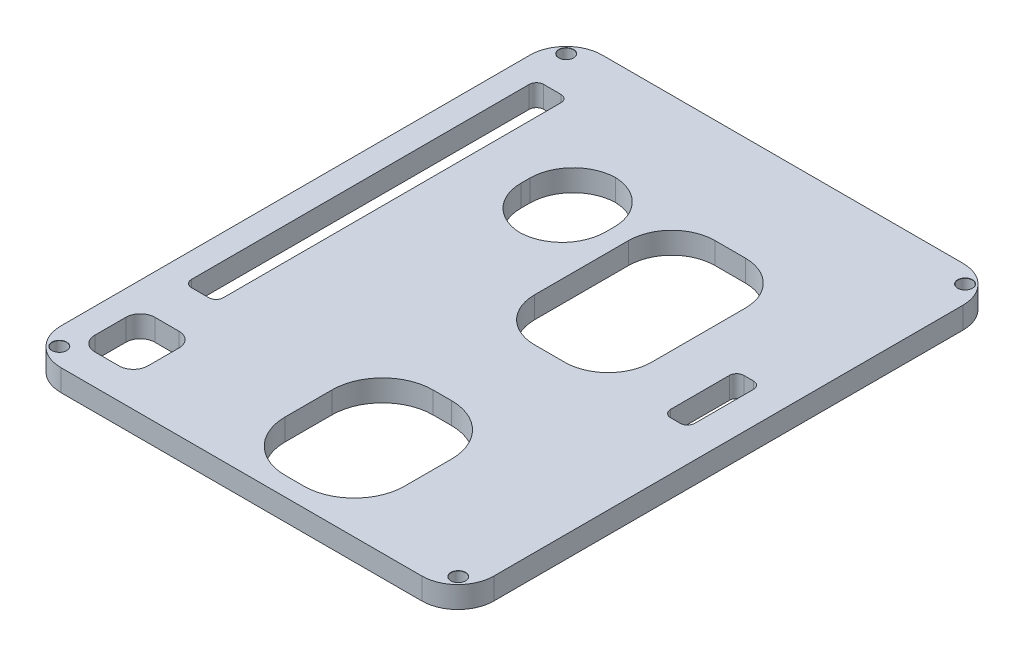
from build123d import *

# Parameters (mm, degrees)
SKIZZE1_W                                = 60
SKIZZE1_H                                = 75
AUFSATZ_LINEAR_AUSTRAGEN1_DEPTH          = 3
VERRUNDUNG1_R                            = 5
F_2_0_2_DURCHMESSER_BOHRUNG1_D           = 2
F_2_0_2_DURCHMESSER_BOHRUNG1_DEPTH       = 20
F_2_0_2_DURCHMESSER_BOHRUNG1_CSINK_D     = 2.05
F_2_0_2_DURCHMESSER_BOHRUNG1_CSINK_ANGLE = 90
F_2_0_2_DURCHMESSER_BOHRUNG1_TIP         = 0.600860619
SKIZZE4_W                                = 25.006881973
SKIZZE4_H                                = 16.195641819
SKIZZE4_W_2                              = 8.317021013
SKIZZE4_H_2                              = 7.361730429
SKIZZE4_W_3                              = 20.485548402
SKIZZE4_H_3                              = 16.578223094
SKIZZE4_W_4                              = 10.159045801
SKIZZE4_H_4                              = 3.349135978
SKIZZE4_W_5                              = 48.785747421
SKIZZE4_H_5                              = 4.403326981
SKIZZE4_W_6                              = 13.233304068
SKIZZE4_H_6                              = 11.709766254
SCHNITT_LINEAR_AUSTRAGEN1_DEPTH          = 5
VERRUNDUNG2_R                            = 6
VERRUNDUNG3_R                            = 1
VERRUNDUNG4_R                            = 7
VERRUNDUNG5_R                            = 2


with BuildPart() as part:
    # Skizze1 → Aufsatz-Linear austragen1 (new body)
    with BuildSketch(Plane(origin=(0, 0, 0), x_dir=(1, 0, 0), z_dir=(0, 1, 0))):
        Rectangle(SKIZZE1_W, SKIZZE1_H)
    extrude(amount=AUFSATZ_LINEAR_AUSTRAGEN1_DEPTH)

    # Verrundung1
    verrundung1_edges = [part.edges().sort_by_distance(p)[0] for p in [
        (30, 1.5, 37.5),
        (-30, 1.5, 37.5),
        (-30, 1.5, -37.5),
        (30, 1.5, -37.5),
    ]]
    fillet(verrundung1_edges, radius=VERRUNDUNG1_R)

    # Ø2.0 (2) Durchmesser Bohrung1
    with Locations(Plane.ZX.offset(3)):
        with Locations((-35.165927774, 27.602462356), (35.054289908, 27.602462356), (35.054289908, -27.658281289), (-35.165927774, -27.658281289)):
            CounterSinkHole(F_2_0_2_DURCHMESSER_BOHRUNG1_D / 2, F_2_0_2_DURCHMESSER_BOHRUNG1_CSINK_D / 2, depth=F_2_0_2_DURCHMESSER_BOHRUNG1_DEPTH, counter_sink_angle=F_2_0_2_DURCHMESSER_BOHRUNG1_CSINK_ANGLE)
            with Locations((0, 0, -(F_2_0_2_DURCHMESSER_BOHRUNG1_DEPTH + F_2_0_2_DURCHMESSER_BOHRUNG1_TIP / 2))):  # 118° drill point
                Cone(0, F_2_0_2_DURCHMESSER_BOHRUNG1_D / 2, F_2_0_2_DURCHMESSER_BOHRUNG1_TIP, mode=Mode.SUBTRACT)

    # Skizze4 → Schnitt-Linear austragen1 (cut)
    with BuildSketch(Plane.ZX.offset(3)):
        with Locations((-10.549778333, 7.176808516)):
            Rectangle(SKIZZE4_W, SKIZZE4_H)
        with Locations((29.109573547, -22.854668692)):
            Rectangle(SKIZZE4_W_2, SKIZZE4_H_2)
        with Locations((24.644058909, 4.744609303)):
            Rectangle(SKIZZE4_W_3, SKIZZE4_H_3)
        with Locations((-3.795687443, 23.91841278)):
            Rectangle(SKIZZE4_W_4, SKIZZE4_H_4)
        with Locations((-5.526074365, -24.333870416)):
            Rectangle(SKIZZE4_W_5, SKIZZE4_H_5)
        with Locations((-17.106394481, -9.399385371)):
            Rectangle(SKIZZE4_W_6, SKIZZE4_H_6)
    extrude(amount=-SCHNITT_LINEAR_AUSTRAGEN1_DEPTH, mode=Mode.SUBTRACT)

    # Verrundung2
    # the kernel refuses this fillet: 6 mm, written as the material it adds along each edge
    with BuildSketch(Plane(origin=(-15.254268498, 3, -23.723046515), x_dir=(1, 0, 0), z_dir=(0, -1, 0)), Plane(origin=(-3.544502244, 3, -23.723046515), x_dir=(0, 0, 1), z_dir=(0, -1, 0)), Plane(origin=(-3.544502244, 3, -10.489742447), x_dir=(-1, 0, 0), z_dir=(0, -1, 0)), Plane(origin=(-0.921012394, 3, -23.053219319), x_dir=(1, 0, 0), z_dir=(0, -1, 0)), Plane(origin=(15.274629425, 3, -23.053219319), x_dir=(0, 0, 1), z_dir=(0, -1, 0)), Plane(origin=(15.274629425, 3, 1.953662654), x_dir=(-1, 0, 0), z_dir=(0, -1, 0))) as verrundung2_piece_1:
        with BuildLine():
            CenterArc((VERRUNDUNG2_R, VERRUNDUNG2_R), VERRUNDUNG2_R, 180, 90)
            Line((0, VERRUNDUNG2_R), (0, 0))
            Line((0, 0), (VERRUNDUNG2_R, 0))
        make_face()
    extrude(amount=3)
    with BuildSketch(Plane(origin=(-15.254268498, 3, -10.489742447), x_dir=(1, 0, 0), z_dir=(0, -1, 0)), Plane(origin=(-0.921012394, 3, 1.953662654), x_dir=(1, 0, 0), z_dir=(0, -1, 0))) as verrundung2_piece_2:
        with BuildLine():
            CenterArc((VERRUNDUNG2_R, -VERRUNDUNG2_R), VERRUNDUNG2_R, 90, 90)
            Line((0, -VERRUNDUNG2_R), (0, 0))
            Line((0, 0), (VERRUNDUNG2_R, 0))
        make_face()
    extrude(amount=3)

    # Verrundung3
    verrundung3_edges = [part.edges().sort_by_distance(p)[0] for p in [
        (-26.535533906, 1.5, -29.918948075),
        (-22.132206925, 1.5, -29.918948075),
        (-22.132206925, 1.5, 18.866799346),
        (-26.535533906, 1.5, 18.866799346),
        (22.243844791, 1.5, -8.875210343),
        (25.592980769, 1.5, -8.875210343),
        (25.592980769, 1.5, 1.283835458),
        (22.243844791, 1.5, 1.283835458),
    ]]
    fillet(verrundung3_edges, radius=VERRUNDUNG3_R)

    # Verrundung4
    verrundung4_edges = [part.edges().sort_by_distance(p)[0] for p in [
        (-3.544502244, 1.5, 14.401284708),
        (13.03372085, 1.5, 14.401284708),
        (13.03372085, 1.5, 34.88683311),
        (-3.544502244, 1.5, 34.88683311),
    ]]
    fillet(verrundung4_edges, radius=VERRUNDUNG4_R)

    # Verrundung5
    verrundung5_edges = [part.edges().sort_by_distance(p)[0] for p in [
        (-26.535533906, 1.5, 24.95106304),
        (-19.173803477, 1.5, 24.95106304),
        (-19.173803477, 1.5, 33.268084053),
        (-26.535533906, 1.5, 33.268084053),
    ]]
    fillet(verrundung5_edges, radius=VERRUNDUNG5_R)


solid = part.part
